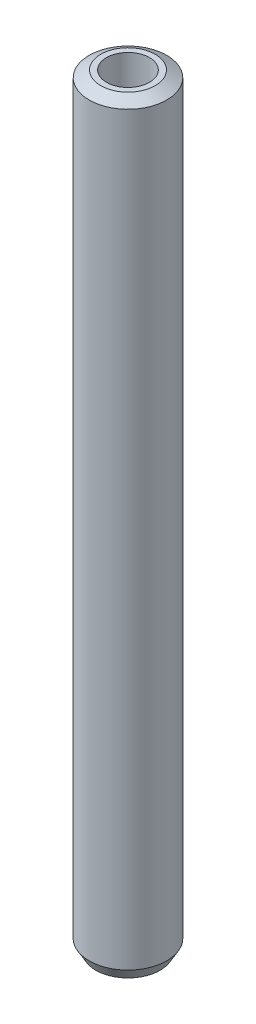
from build123d import *
from OCP.BRepFilletAPI import BRepFilletAPI_MakeChamfer

# Parameters (mm, degrees)
SKETCH1_R           = 12.5
BOSS_EXTRUDE1_DEPTH = 246.283178972
SKETCH2_R           = 6.929163014
CUT_EXTRUDE1_DEPTH  = 247.916796197
CHAMFER1_SIZE       = 2.149683025
CHAMFER1_SIZE2      = 3.723360219


with BuildPart() as part:
    # Sketch1 → Boss-Extrude1 (new body)
    with BuildSketch(Plane(origin=(0, 0, 0), x_dir=(1, 0, 0), z_dir=(0, 1, 0))):
        Circle(SKETCH1_R)
    extrude(amount=BOSS_EXTRUDE1_DEPTH)

    # Sketch2 → Cut-Extrude1 (cut, through all)
    with BuildSketch(Plane(origin=(0, 0, 0), x_dir=(1, 0, 0), z_dir=(0, 1, 0))):
        Circle(SKETCH2_R)
    extrude(amount=CUT_EXTRUDE1_DEPTH, mode=Mode.SUBTRACT)

    # Chamfer1: one chamfer whose edges measure the first distance from different faces: ONE call of the kernel's chamfer builder (chamfer() names one face for all edges)
    chamfer1_edges_1 = [part.edges().sort_by_distance(p)[0] for p in [
        (-12.5, 246.283178972, 0),
    ]]
    chamfer1_side_1 = [part.faces().sort_by_distance(p)[0] for p in [
        (-12.5, 123.141589486, 0),
    ]]
    chamfer1_edges_2 = [part.edges().sort_by_distance(p)[0] for p in [
        (-12.5, 0, 0),
    ]]
    chamfer1_side_2 = [part.faces().sort_by_distance(p)[0] for p in [
        (-12.146446609, 0, 0),
    ]]
    chamfer1 = BRepFilletAPI_MakeChamfer(part.part.solid().wrapped)
    for e in chamfer1_edges_1:
        chamfer1.Add(CHAMFER1_SIZE, CHAMFER1_SIZE2, e.wrapped, chamfer1_side_1[0].wrapped)  # the first distance lies on this face
    for e in chamfer1_edges_2:
        chamfer1.Add(CHAMFER1_SIZE, CHAMFER1_SIZE2, e.wrapped, chamfer1_side_2[0].wrapped)  # the first distance lies on this face
    add(Compound.cast(chamfer1.Shape()), mode=Mode.REPLACE)


solid = part.part
